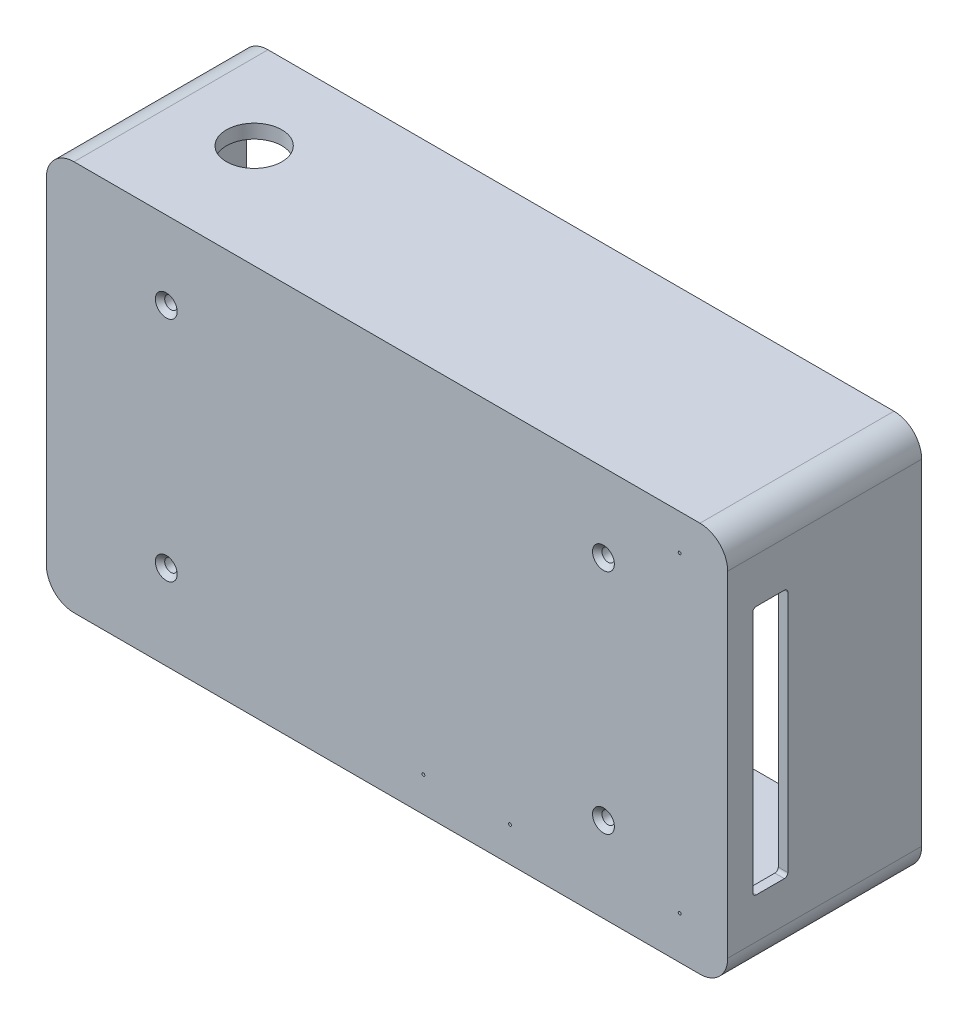
from build123d import *

# Parameters (mm, degrees)
BOSS_EXTRUDE2_DEPTH                                  = 55
WANDUNG2_DEPTH                                       = 51
CUT_EXTRUDE7_REACH                                   = 216.524
FORMSENKUNG_F_R_M3_LINSENSENKSCHRAUBE_MI_D           = 3.6
FORMSENKUNG_F_R_M3_LINSENSENKSCHRAUBE_MI_CSINK_D     = 6.3
FORMSENKUNG_F_R_M3_LINSENSENKSCHRAUBE_MI_CSINK_ANGLE = 90
SCHNITT_LINEAR_AUSTRAGEN1_REACH                      = 216.524
SCHNITT_LINEAR_AUSTRAGEN2_REACH                      = 162.488
FORMSENKUNG_F_R_M3_LINSENSENKSCHRAUB_2_D             = 3.4
FORMSENKUNG_F_R_M3_LINSENSENKSCHRAUB_2_DEPTH         = 4
FORMSENKUNG_F_R_M3_LINSENSENKSCHRAUB_2_CSINK_D       = 6.3
FORMSENKUNG_F_R_M3_LINSENSENKSCHRAUB_2_CSINK_ANGLE   = 90
SCHNITT_LINEAR_AUSTRAGEN4_REACH                      = 162.488
SKIZZE11_R                                           = 8
SKETCH30_R                                           = 2.5
AUFSATZ_LINEAR_AUSTRAGEN1_DEPTH                      = 1.5
AUFSATZ_LINEAR_AUSTRAGEN1_2_DEPTH                    = 1.5
AUFSATZ_LINEAR_AUSTRAGEN1_3_DEPTH                    = 1.5
AUFSATZ_LINEAR_AUSTRAGEN1_4_DEPTH                    = 1.5
M3_GEWINDEBOHRUNG7_AT_2_COUNT                        = 2
M3_GEWINDEBOHRUNG7_AT_2_PITCH                        = 58
M3_GEWINDEBOHRUNG7_AT_3_COUNT                        = 2
M3_GEWINDEBOHRUNG7_AT_3_PITCH                        = 75.927597091
M3_GEWINDEBOHRUNG7_AT_4_COUNT                        = 2
M3_GEWINDEBOHRUNG7_AT_4_PITCH                        = 49
AUFSATZ_LINEAR_AUSTRAGEN4_DEPTH                      = 1
VERRUNDUNG5_R                                        = 9
VERRUNDUNG6_R                                        = 9
M3_GEWINDEBOHRUNG9_AT_2_COUNT                        = 2
M3_GEWINDEBOHRUNG9_AT_2_PITCH                        = 25
AUFSATZ_LINEAR_START                                 = -51
AUFSATZ_LINEAR_AUSTRAGEN5_DEPTH                      = 51
SKIZZE28_3_R                                         = 2.5
AUFSATZ_LINEAR_AUSTRAGEN6_DEPTH                      = 1
AUFSATZ_LINEAR_START_2                               = 51
AUFSATZ_LINEAR_AUSTRAGEN7_DEPTH                      = 51
M3_GEWINDEBOHRUNG15_AT_2_COUNT                       = 2
M3_GEWINDEBOHRUNG15_AT_2_PITCH                       = 90.05
AUFSATZ_LINEAR_START_3                               = 1
AUFSATZ_LINEAR_AUSTRAGEN8_DEPTH                      = 1


# Read off the part's stored shape, not the designer's step: Wandung2
with BuildPart() as part:
    # Sketch3 → Boss-Extrude2 (new body)
    with BuildSketch(Plane.XY):
        with BuildLine():
            Line((92.083443301, -47.151237912), (-88.616556699, -47.151237912))
            ThreePointArc((-88.616556699, -47.151237912), (-94.273410949, -44.808092161), (-96.616556699, -39.151237912))
            Line((-96.616556699, -39.151237912), (-96.616556699, 57.608762088))
            ThreePointArc((-96.616556699, 57.608762088), (-94.273410949, 63.265616338), (-88.616556699, 65.608762088))
            Line((-88.616556699, 65.608762088), (92.083443301, 65.608762088))
            ThreePointArc((92.083443301, 65.608762088), (97.74029755, 63.265616338), (100.083443301, 57.608762088))
            Line((100.083443301, 57.608762088), (100.083443301, -39.151237912))
            ThreePointArc((100.083443301, -39.151237912), (97.74029755, -44.808092161), (92.083443301, -47.151237912))
        make_face()
    extrude(amount=BOSS_EXTRUDE2_DEPTH)

    # Wandung2 outline → Wandung2 (cut)
    with BuildSketch(Plane.XY):
        with BuildLine():
            ThreePointArc((95.483810928, -43.151237912), (96.848652113, -41.354709032), (97.333443301, -39.151237912))
            Line((97.333443301, -39.151237912), (97.333443301, 57.608762088))
            ThreePointArc((97.333443301, 57.608762088), (94.286914421, 62.3739709), (88.683075674, 61.608762088))
            Line((88.683075674, 61.608762088), (-85.216189072, 61.608762088))
            ThreePointArc((-85.216189072, 61.608762088), (-90.82002782, 62.3739709), (-93.866556699, 57.608762088))
            Line((-93.866556699, 57.608762088), (-93.866556699, -39.151237912))
            ThreePointArc((-93.866556699, -39.151237912), (-90.82002782, -43.916446724), (-85.216189072, -43.151237912))
            Line((-85.216189072, -43.151237912), (95.483810928, -43.151237912))
        make_face()
    extrude(amount=WANDUNG2_DEPTH, mode=Mode.SUBTRACT)

    # Sketch24 → Cut-Extrude7 (cut, up to next)
    with BuildSketch(Plane.ZY.offset(96.616556699), mode=Mode.PRIVATE) as cut_extrude7_sk1:
        with BuildLine():
            Line((32.8, 39.358762088), (47, 39.358762088))
            ThreePointArc((47, 39.358762088), (47.707106781, 39.065868869), (48, 38.358762088))
            Line((48, 38.358762088), (48, 24.858762088))
            ThreePointArc((48, 24.858762088), (47.707106781, 24.151655307), (47, 23.858762088))
            Line((47, 23.858762088), (32.8, 23.858762088))
            ThreePointArc((32.8, 23.858762088), (32.092893219, 24.151655307), (31.8, 24.858762088))
            Line((31.8, 24.858762088), (31.8, 38.358762088))
            ThreePointArc((31.8, 38.358762088), (32.092893219, 39.065868869), (32.8, 39.358762088))
        make_face()
    cut_extrude7_tool1 = extrude(cut_extrude7_sk1.sketch, amount=-CUT_EXTRUDE7_REACH, mode=Mode.PRIVATE) & part.part
    # Sketch24 → Cut-Extrude7 (cut, up to next)
    with BuildSketch(Plane.ZY.offset(96.616556699), mode=Mode.PRIVATE) as cut_extrude7_sk2:
        with BuildLine():
            Line((32.8, 5.858762088), (47, 5.858762088))
            ThreePointArc((47, 5.858762088), (47.707106781, 6.151655307), (48, 6.858762088))
            Line((48, 6.858762088), (48, 20.358762088))
            ThreePointArc((48, 20.358762088), (47.707106781, 21.065868869), (47, 21.358762088))
            Line((47, 21.358762088), (32.8, 21.358762088))
            ThreePointArc((32.8, 21.358762088), (32.092893219, 21.065868869), (31.8, 20.358762088))
            Line((31.8, 20.358762088), (31.8, 6.858762088))
            ThreePointArc((31.8, 6.858762088), (32.092893219, 6.151655307), (32.8, 5.858762088))
        make_face()
    cut_extrude7_tool2 = extrude(cut_extrude7_sk2.sketch, amount=-CUT_EXTRUDE7_REACH, mode=Mode.PRIVATE) & part.part
    # Sketch24 → Cut-Extrude7 (cut, up to next)
    with BuildSketch(Plane.ZY.offset(96.616556699), mode=Mode.PRIVATE) as cut_extrude7_sk3:
        with BuildLine():
            Line((34.7, 3.258762088), (47.3, 3.258762088))
            ThreePointArc((47.3, 3.258762088), (48.007106781, 2.965868869), (48.3, 2.258762088))
            Line((48.3, 2.258762088), (48.3, -12.541237912))
            ThreePointArc((48.3, -12.541237912), (48.007106781, -13.248344693), (47.3, -13.541237912))
            Line((47.3, -13.541237912), (34.7, -13.541237912))
            ThreePointArc((34.7, -13.541237912), (33.992893219, -13.248344693), (33.7, -12.541237912))
            Line((33.7, -12.541237912), (33.7, 2.258762088))
            ThreePointArc((33.7, 2.258762088), (33.992893219, 2.965868869), (34.7, 3.258762088))
        make_face()
    cut_extrude7_tool3 = extrude(cut_extrude7_sk3.sketch, amount=-CUT_EXTRUDE7_REACH, mode=Mode.PRIVATE) & part.part
    add(cut_extrude7_tool1.solids().sort_by_distance((-96.616557, 31.608762, 39.9))[0], mode=Mode.SUBTRACT)
    add(cut_extrude7_tool2.solids().sort_by_distance((-96.616557, 13.608762, 39.9))[0], mode=Mode.SUBTRACT)
    add(cut_extrude7_tool3.solids().sort_by_distance((-96.616557, -5.141238, 41))[0], mode=Mode.SUBTRACT)

    # Formsenkung f_r M3 Linsensenkschraube mi (through all)
    with Locations(Plane(origin=(-61.986556699, 43.028762088, 55), x_dir=(1, 0, 0), z_dir=(0, 0, 1))):
        with Locations((0, 0), (126.2, -65.65), (126.2, 0), (0, -65.65)):
            CounterSinkHole(FORMSENKUNG_F_R_M3_LINSENSENKSCHRAUBE_MI_D / 2, FORMSENKUNG_F_R_M3_LINSENSENKSCHRAUBE_MI_CSINK_D / 2, counter_sink_angle=FORMSENKUNG_F_R_M3_LINSENSENKSCHRAUBE_MI_CSINK_ANGLE)

    # Skizze3 → Schnitt-Linear austragen1 (cut, up to next)
    with BuildSketch(Plane(origin=(100.083443301, 0, 0), x_dir=(0, 0, -1), z_dir=(1, 0, 0)), mode=Mode.PRIVATE) as schnitt_linear_austragen1_sk1:
        with BuildLine():
            Line((-46.75, 44.678762088), (-38.65, 44.678762088))
            ThreePointArc((-38.65, 44.678762088), (-37.942893219, 44.385868869), (-37.65, 43.678762088))
            Line((-37.65, 43.678762088), (-37.65, -26.421237912))
            ThreePointArc((-37.65, -26.421237912), (-37.942893219, -27.128344693), (-38.65, -27.421237912))
            Line((-38.65, -27.421237912), (-46.75, -27.421237912))
            ThreePointArc((-46.75, -27.421237912), (-47.457106781, -27.128344693), (-47.75, -26.421237912))
            Line((-47.75, -26.421237912), (-47.75, 43.678762088))
            ThreePointArc((-47.75, 43.678762088), (-47.457106781, 44.385868869), (-46.75, 44.678762088))
        make_face()
    schnitt_linear_austragen1_tool1 = extrude(schnitt_linear_austragen1_sk1.sketch, amount=-SCHNITT_LINEAR_AUSTRAGEN1_REACH, mode=Mode.PRIVATE) & part.part
    add(schnitt_linear_austragen1_tool1.solids().sort_by_distance((100.083443, 8.628762, 42.7))[0], mode=Mode.SUBTRACT)

    # Skizze4 → Schnitt-Linear austragen2 (cut, up to next)
    with BuildSketch(Plane.XZ.offset(47.151237912), mode=Mode.PRIVATE) as schnitt_linear_austragen2_sk1:
        with BuildLine():
            Line((6.433443301, 36.2), (-4.666556699, 36.2))
            ThreePointArc((-4.666556699, 36.2), (-5.37366348, 36.492893219), (-5.666556699, 37.2))
            Line((-5.666556699, 37.2), (-5.666556699, 47.3))
            ThreePointArc((-5.666556699, 47.3), (-5.37366348, 48.007106781), (-4.666556699, 48.3))
            Line((-4.666556699, 48.3), (6.433443301, 48.3))
            ThreePointArc((6.433443301, 48.3), (7.140550082, 48.007106781), (7.433443301, 47.3))
            Line((7.433443301, 47.3), (7.433443301, 37.2))
            ThreePointArc((7.433443301, 37.2), (7.140550082, 36.492893219), (6.433443301, 36.2))
        make_face()
    schnitt_linear_austragen2_tool1 = extrude(schnitt_linear_austragen2_sk1.sketch, amount=-SCHNITT_LINEAR_AUSTRAGEN2_REACH, mode=Mode.PRIVATE) & part.part
    # Skizze4 → Schnitt-Linear austragen2 (cut, up to next)
    with BuildSketch(Plane.XZ.offset(47.151237912), mode=Mode.PRIVATE) as schnitt_linear_austragen2_sk2:
        with BuildLine():
            Line((-15.566556699, 40.3), (-25.566556699, 40.3))
            ThreePointArc((-25.566556699, 40.3), (-26.27366348, 40.592893219), (-26.566556699, 41.3))
            Line((-26.566556699, 41.3), (-26.566556699, 47.3))
            ThreePointArc((-26.566556699, 47.3), (-26.27366348, 48.007106781), (-25.566556699, 48.3))
            Line((-25.566556699, 48.3), (-15.566556699, 48.3))
            ThreePointArc((-15.566556699, 48.3), (-14.859449918, 48.007106781), (-14.566556699, 47.3))
            Line((-14.566556699, 47.3), (-14.566556699, 41.3))
            ThreePointArc((-14.566556699, 41.3), (-14.859449918, 40.592893219), (-15.566556699, 40.3))
        make_face()
    schnitt_linear_austragen2_tool2 = extrude(schnitt_linear_austragen2_sk2.sketch, amount=-SCHNITT_LINEAR_AUSTRAGEN2_REACH, mode=Mode.PRIVATE) & part.part
    add(schnitt_linear_austragen2_tool1.solids().sort_by_distance((0.883443, -47.151238, 42.25))[0], mode=Mode.SUBTRACT)
    add(schnitt_linear_austragen2_tool2.solids().sort_by_distance((-20.566557, -47.151238, 44.3))[0], mode=Mode.SUBTRACT)

    # Formsenkung f_r M3 Linsensenkschraub 2
    with Locations(Plane(origin=(-11.566556699, -47.151237912, 44.3), x_dir=(-1, 0, 0), z_dir=(0, -1, 0))):
        with Locations((0, 0), (18, 0)):
            CounterSinkHole(FORMSENKUNG_F_R_M3_LINSENSENKSCHRAUB_2_D / 2, FORMSENKUNG_F_R_M3_LINSENSENKSCHRAUB_2_CSINK_D / 2, depth=FORMSENKUNG_F_R_M3_LINSENSENKSCHRAUB_2_DEPTH, counter_sink_angle=FORMSENKUNG_F_R_M3_LINSENSENKSCHRAUB_2_CSINK_ANGLE)

    # Skizze11 → Schnitt-Linear austragen4 (cut, up to next)
    with BuildSketch(Plane(origin=(0, 65.608762088, 0), x_dir=(1, 0, 0), z_dir=(0, 1, 0)), mode=Mode.PRIVATE) as schnitt_linear_austragen4_sk1:
        with Locations(Location((-66.616556699, -25, 0), (0, 0, 180))):
            Circle(SKIZZE11_R)
    schnitt_linear_austragen4_tool1 = extrude(schnitt_linear_austragen4_sk1.sketch, amount=-SCHNITT_LINEAR_AUSTRAGEN4_REACH, mode=Mode.PRIVATE) & part.part
    add(schnitt_linear_austragen4_tool1.solids().sort_by_distance((-66.616557, 65.608762, 25))[0], mode=Mode.SUBTRACT)


with BuildPart() as body_2:
    # Sketch30 → Aufsatz-Linear austragen1 (new body)
    with BuildSketch(Plane.XY.offset(51)):
        with Locations((-12.366556699, 37.108762088)):
            Circle(SKETCH30_R)
    extrude(amount=-AUFSATZ_LINEAR_AUSTRAGEN1_DEPTH)


with BuildPart() as body_3:
    # Sketch30 → Aufsatz-Linear austragen1 2 (new body)
    with BuildSketch(Plane.XY.offset(51)):
        with Locations((-70.366556699, 37.108762088)):
            Circle(SKETCH30_R)
    extrude(amount=-AUFSATZ_LINEAR_AUSTRAGEN1_2_DEPTH)


with BuildPart() as body_4:
    # Sketch30 → Aufsatz-Linear austragen1 3 (new body)
    with BuildSketch(Plane.XY.offset(51)):
        with Locations((-12.366556699, -11.891237912)):
            Circle(SKETCH30_R)
    extrude(amount=-AUFSATZ_LINEAR_AUSTRAGEN1_3_DEPTH)


with BuildPart() as body_5:
    # Sketch30 → Aufsatz-Linear austragen1 4 (new body)
    with BuildSketch(Plane.XY.offset(51)):
        with Locations((-70.366556699, -11.891237912)):
            Circle(SKETCH30_R)
    extrude(amount=-AUFSATZ_LINEAR_AUSTRAGEN1_4_DEPTH)


with BuildPart() as m3_gewindebohrung7_tool:
    # Skizze40 → M3 Gewindebohrung7 (revolve)
    with BuildSketch(Plane(origin=(-70.366556699, -11.891237912, 49.5), x_dir=(0, 1, 0), z_dir=(1, 0, 0))):
        Polygon((0, 0), (0, 4.751075774), (1.25, 4), (1.25, 0.275), (1.525, 0), align=None)
    m3_gewindebohrung7 = revolve(axis=Axis((-70.366556699, -11.891237912, 43.15), (0, 0, 1)))


with BuildPart() as part_1:
    add(part.part)

    # M3 Gewindebohrung7: cut by m3_gewindebohrung7_tool
    add(m3_gewindebohrung7_tool.part, mode=Mode.SUBTRACT)


with BuildPart() as body_5_1:
    add(body_5.part)

    # M3 Gewindebohrung7: cut by m3_gewindebohrung7_tool
    add(m3_gewindebohrung7_tool.part, mode=Mode.SUBTRACT)


with BuildPart() as m3_gewindebohrung7_at_2_tool:
    # M3 Gewindebohrung7 at 2: M3 Gewindebohrung7 ×2
    with Locations(*[(i * M3_GEWINDEBOHRUNG7_AT_2_PITCH, 0, 0) for i in range(1, M3_GEWINDEBOHRUNG7_AT_2_COUNT)]):
        add(m3_gewindebohrung7)


with BuildPart() as part_2:
    add(part_1.part)

    # M3 Gewindebohrung7 at 2: cut by m3_gewindebohrung7_at_2_tool
    add(m3_gewindebohrung7_at_2_tool.part, mode=Mode.SUBTRACT)


with BuildPart() as body_4_1:
    add(body_4.part)

    # M3 Gewindebohrung7 at 2: cut by m3_gewindebohrung7_at_2_tool
    add(m3_gewindebohrung7_at_2_tool.part, mode=Mode.SUBTRACT)


with BuildPart() as m3_gewindebohrung7_at_3_tool:
    # M3 Gewindebohrung7 at 3: M3 Gewindebohrung7 ×2
    with Locations(*[Vector(0.7638856255460444, 0.6453516491682101, 0) * (i * M3_GEWINDEBOHRUNG7_AT_3_PITCH) for i in range(1, M3_GEWINDEBOHRUNG7_AT_3_COUNT)]):
        add(m3_gewindebohrung7)


with BuildPart() as part_3:
    add(part_2.part)

    # M3 Gewindebohrung7 at 3: cut by m3_gewindebohrung7_at_3_tool
    add(m3_gewindebohrung7_at_3_tool.part, mode=Mode.SUBTRACT)


with BuildPart() as body_2_1:
    add(body_2.part)

    # M3 Gewindebohrung7 at 3: cut by m3_gewindebohrung7_at_3_tool
    add(m3_gewindebohrung7_at_3_tool.part, mode=Mode.SUBTRACT)


with BuildPart() as m3_gewindebohrung7_at_4_tool:
    # M3 Gewindebohrung7 at 4: M3 Gewindebohrung7 ×2
    with Locations(*[(0, i * M3_GEWINDEBOHRUNG7_AT_4_PITCH, 0) for i in range(1, M3_GEWINDEBOHRUNG7_AT_4_COUNT)]):
        add(m3_gewindebohrung7)


with BuildPart() as part_4:
    add(part_3.part)

    # M3 Gewindebohrung7 at 4: cut by m3_gewindebohrung7_at_4_tool
    add(m3_gewindebohrung7_at_4_tool.part, mode=Mode.SUBTRACT)

    # Skizze32 → Aufsatz-Linear austragen4 (add)
    with BuildSketch(Plane(origin=(0, 0, 51), x_dir=(-1, 0, 0), z_dir=(0, 0, -1))):
        with BuildLine():
            ThreePointArc((-7.551657645, -37.151237912), (-8.922920915, -33.840715526), (-12.233443301, -32.469452256))
            Line((-12.233443301, -32.469452256), (-12.233443301, -32.469147308))
            Line((-12.233443301, -32.469147308), (-37.233443301, -32.250493473))
            ThreePointArc((-37.233443301, -32.250493473), (-40.698792926, -33.685888286), (-42.13418774, -37.151237912))
            ThreePointArc((-42.13418774, -37.151237912), (-45.109459054, -41.106960857), (-49.617331583, -43.151237912))
            Line((-49.617331583, -43.151237912), (0.62218267, -43.151237912))
            ThreePointArc((0.62218267, -43.151237912), (-4.281588174, -41.264039091), (-7.551657645, -37.151237912))
        make_face()
    extrude(amount=AUFSATZ_LINEAR_AUSTRAGEN4_DEPTH)

    # Verrundung5
    verrundung5_edges = [part_4.edges().sort_by_distance(p)[0] for p in [
        (7.551657645, -37.151237912, 50.5),
    ]]
    fillet(verrundung5_edges, radius=VERRUNDUNG5_R)

    # Verrundung6
    verrundung6_edges = [part_4.edges().sort_by_distance(p)[0] for p in [
        (42.13418774, -37.151237912, 50.5),
    ]]
    fillet(verrundung6_edges, radius=VERRUNDUNG6_R)

    # Skizze48 → M3 Gewindebohrung9 (revolve, cut)
    with BuildSketch(Plane(origin=(37.233443301, -37.151237912, 50), x_dir=(0, 1, 0), z_dir=(1, 0, 0))):
        Polygon((0, 0), (0, 5.251075774), (1.25, 4.5), (1.25, 0.275), (1.525, 0), align=None)
    m3_gewindebohrung9 = revolve(axis=Axis((37.233443301, -37.151237912, 43.65), (0, 0, 1)), mode=Mode.SUBTRACT)

    # M3 Gewindebohrung9 at 2: M3 Gewindebohrung9 ×2
    with Locations(*[(-i * M3_GEWINDEBOHRUNG9_AT_2_PITCH, 0, 0) for i in range(1, M3_GEWINDEBOHRUNG9_AT_2_COUNT)]):
        add(m3_gewindebohrung9, mode=Mode.SUBTRACT)

    # Skizze28 → Aufsatz-Linear austragen5 (add)
    with BuildSketch(Plane.XY.offset(51).offset(AUFSATZ_LINEAR_START)):
        with BuildLine():
            ThreePointArc((88.683075674, 61.608762088), (94.631666025, 59.636529484), (97.333443301, 53.981812147))
            Line((97.333443301, 53.981812147), (97.333443301, 57.608762088))
            ThreePointArc((97.333443301, 57.608762088), (94.286914421, 62.3739709), (88.683075674, 61.608762088))
        make_face()
        with BuildLine():
            Line((97.333443301, -39.151237912), (97.333443301, -38.456855061))
            ThreePointArc((97.333443301, -38.456855061), (94.659111761, -41.62568452), (90.803438516, -43.151237912))
            Line((90.803438516, -43.151237912), (95.483810928, -43.151237912))
            ThreePointArc((95.483810928, -43.151237912), (96.848652113, -41.354709032), (97.333443301, -39.151237912))
        make_face()
    extrude(amount=AUFSATZ_LINEAR_AUSTRAGEN5_DEPTH)

    # Skizze28<3> → Aufsatz-Linear austragen6 (add)
    with BuildSketch(Plane.XY.offset(51)):
        with Locations(Location((86.213443301, -34.821237912, 0), (0, 0, 180))):
            Circle(SKIZZE28_3_R)
        with BuildLine():
            ThreePointArc((86.213443301, 52.728762088), (88.158023696, 56.799942246), (83.769214396, 55.753876418))
            ThreePointArc((83.769214396, 55.753876418), (83.747416513, 55.490672697), (83.713443301, 55.228762088))
            ThreePointArc((83.713443301, 55.228762088), (84.445676348, 53.460995135), (86.213443301, 52.728762088))
        make_face()
    extrude(amount=-AUFSATZ_LINEAR_AUSTRAGEN6_DEPTH)

    # Skizze51 → Aufsatz-Linear austragen7 (add)
    with BuildSketch(Plane(origin=(0, 0, 51), x_dir=(-1, 0, 0), z_dir=(0, 0, -1)).offset(AUFSATZ_LINEAR_START_2)):
        with BuildLine():
            ThreePointArc((93.866556699, -36.466347236), (90.535745242, -41.095528118), (85.216189072, -43.151237912))
            ThreePointArc((85.216189072, -43.151237912), (90.82002782, -43.916446724), (93.866556699, -39.151237912))
            Line((93.866556699, -39.151237912), (93.866556699, -36.466347236))
        make_face()
        with BuildLine():
            ThreePointArc((84.864037739, 61.608762088), (90.109653235, 60.063091031), (93.866556699, 56.089269533))
            Line((93.866556699, 56.089269533), (93.866556699, 57.608762088))
            ThreePointArc((93.866556699, 57.608762088), (90.82002782, 62.3739709), (85.216189072, 61.608762088))
            Line((85.216189072, 61.608762088), (84.864037739, 61.608762088))
        make_face()
    extrude(amount=-AUFSATZ_LINEAR_AUSTRAGEN7_DEPTH)

    # Skizze57 → M3 Gewindebohrung15 (revolve, cut)
    with BuildSketch(Plane(origin=(86.213443301, -34.821237912, 50), x_dir=(0, 1, 0), z_dir=(1, 0, 0))):
        Polygon((0, 0), (0, 5.251075774), (1.25, 4.5), (1.25, 0.275), (1.525, 0), align=None)
    m3_gewindebohrung15 = revolve(axis=Axis((86.213443301, -34.821237912, 43.65), (0, 0, 1)), mode=Mode.SUBTRACT)

    # M3 Gewindebohrung15 at 2: M3 Gewindebohrung15 ×2
    with Locations(*[(0, i * M3_GEWINDEBOHRUNG15_AT_2_PITCH, 0) for i in range(1, M3_GEWINDEBOHRUNG15_AT_2_COUNT)]):
        add(m3_gewindebohrung15, mode=Mode.SUBTRACT)

    # Skizze58 → Aufsatz-Linear austragen8 (add)
    with BuildSketch(Plane(origin=(0, 0, 0), x_dir=(-1, 0, 0), z_dir=(0, 0, -1)).offset(AUFSATZ_LINEAR_START_3)):
        with BuildLine():
            Line((-100.083443301, 57.608762088), (-100.083443301, -39.151237912))
            ThreePointArc((-100.083443301, -39.151237912), (-97.74029755, -44.808092161), (-92.083443301, -47.151237912))
            Line((-92.083443301, -47.151237912), (88.616556699, -47.151237912))
            ThreePointArc((88.616556699, -47.151237912), (94.273410949, -44.808092161), (96.616556699, -39.151237912))
            Line((96.616556699, -39.151237912), (96.616556699, 57.608762088))
            ThreePointArc((96.616556699, 57.608762088), (94.273410949, 63.265616338), (88.616556699, 65.608762088))
            Line((88.616556699, 65.608762088), (-92.083443301, 65.608762088))
            ThreePointArc((-92.083443301, 65.608762088), (-97.74029755, 63.265616338), (-100.083443301, 57.608762088))
        make_face()
        with BuildLine():
            ThreePointArc((-90.713443301, 65.108762088), (-96.37029755, 62.765616338), (-98.713443301, 57.108762088))
            Line((-98.713443301, 57.108762088), (-98.713443301, -38.651237912))
            ThreePointArc((-98.713443301, -38.651237912), (-96.37029755, -44.308092161), (-90.713443301, -46.651237912))
            Line((-90.713443301, -46.651237912), (87.246556699, -46.651237912))
            ThreePointArc((87.246556699, -46.651237912), (92.903410949, -44.308092161), (95.246556699, -38.651237912))
            Line((95.246556699, -38.651237912), (95.246556699, 57.108762088))
            ThreePointArc((95.246556699, 57.108762088), (92.903410949, 62.765616338), (87.246556699, 65.108762088))
            Line((87.246556699, 65.108762088), (-90.713443301, 65.108762088))
        make_face(mode=Mode.SUBTRACT)
    extrude(amount=-AUFSATZ_LINEAR_AUSTRAGEN8_DEPTH)


with BuildPart() as body_3_1:
    add(body_3.part)

    # M3 Gewindebohrung7 at 4: cut by m3_gewindebohrung7_at_4_tool
    add(m3_gewindebohrung7_at_4_tool.part, mode=Mode.SUBTRACT)


solid = Compound([body_5_1.part, body_4_1.part, body_2_1.part, part_4.part, body_3_1.part])
